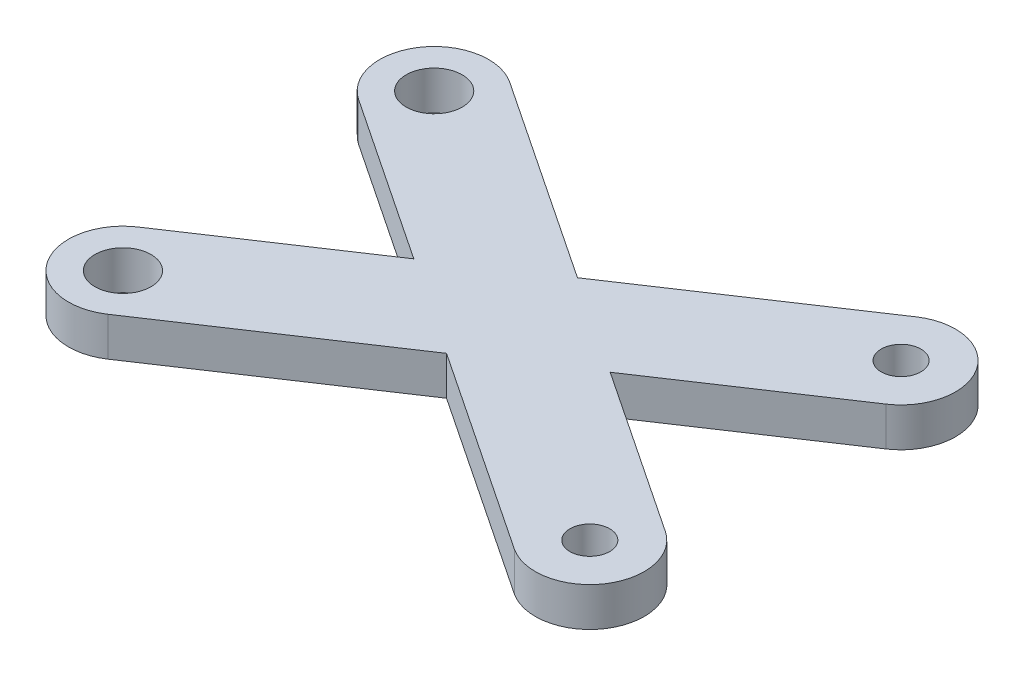
from build123d import *

# Parameters (mm, degrees)
SKETCH1_R           = 3.6
SKETCH1_R_2         = 2.55
BOSS_EXTRUDE1_DEPTH = 5


with BuildPart() as part:
    # Sketch1 → Boss-Extrude1 (new body)
    with BuildSketch(Plane(origin=(0, 0, 0), x_dir=(1, 0, 0), z_dir=(0, 1, 0))):
        with BuildLine():
            ThreePointArc((-26.117098626, 25.82435206), (-35.82435206, 23.882901374), (-33.882901374, 14.17564794))
            Line((-33.882901374, 14.17564794), (-12.619429464, 0))
            Line((-12.619429464, 0), (-33.882901374, -14.17564794))
            ThreePointArc((-33.882901374, -14.17564794), (-35.82435206, -23.882901374), (-26.117098626, -25.82435206))
            Line((-26.117098626, -25.82435206), (0, -8.412952976))
            Line((0, -8.412952976), (26.117098626, -25.82435206))
            ThreePointArc((26.117098626, -25.82435206), (35.82435206, -23.882901374), (33.882901374, -14.17564794))
            Line((33.882901374, -14.17564794), (12.619429464, 0))
            Line((12.619429464, 0), (33.882901374, 14.17564794))
            ThreePointArc((33.882901374, 14.17564794), (35.82435206, 23.882901374), (26.117098626, 25.82435206))
            Line((26.117098626, 25.82435206), (0, 8.412952976))
            Line((0, 8.412952976), (-26.117098626, 25.82435206))
        make_face()
        with Locations((-30, -20)):
            Circle(SKETCH1_R, mode=Mode.SUBTRACT)
        with Locations((30, -20)):
            Circle(SKETCH1_R_2, mode=Mode.SUBTRACT)
        with Locations((-30, 20)):
            Circle(SKETCH1_R, mode=Mode.SUBTRACT)
        with Locations((30, 20)):
            Circle(SKETCH1_R_2, mode=Mode.SUBTRACT)
    extrude(amount=BOSS_EXTRUDE1_DEPTH)


solid = part.part
